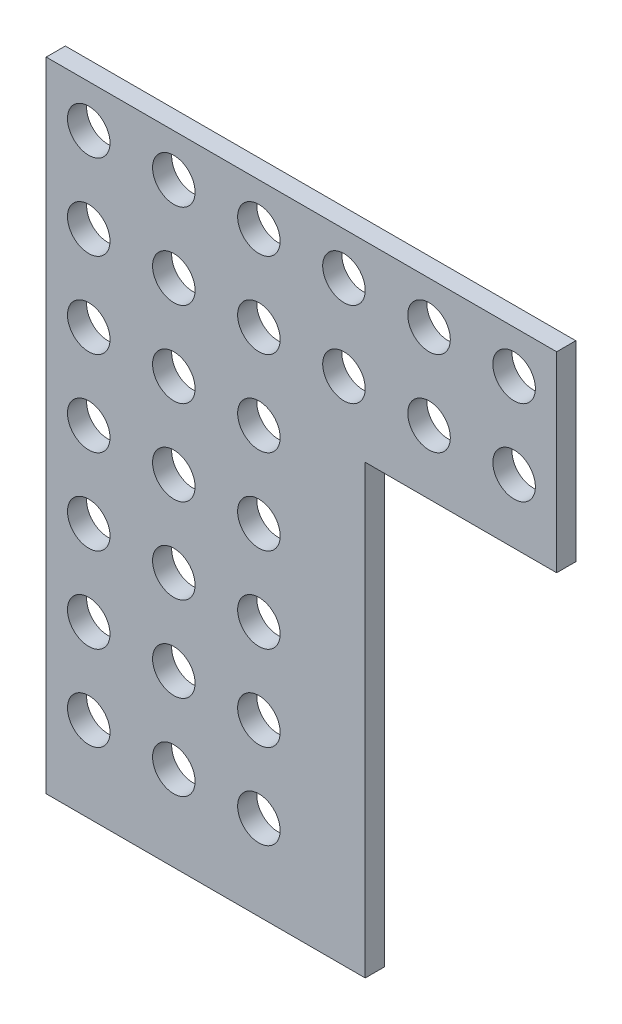
from build123d import *

# Parameters (mm, degrees)
BOSS_EXTRUDE1_DEPTH     = 4.5
SKETCH3_R               = 5
CUT_EXTRUDE1_DEPTH      = 97.152223063
FILL_PATTERN1_OUTLINE_R = 5
FILL_PATTERN1_DEPTH     = 4.5


# Read off the part's stored shape, not the designer's step: Fill Pattern1
with BuildPart() as part:
    # Sketch2 → Boss-Extrude1 (new body)
    with BuildSketch(Plane.XY):
        Polygon((15, -75), (-60, -75), (-60, 75), (60, 75), (60, 30), (15, 30), align=None)
    extrude(amount=BOSS_EXTRUDE1_DEPTH)

    # Sketch3 → Cut-Extrude1 (cut, through all)
    with BuildSketch(Plane.XY.offset(4.5)):
        with Locations((-50, 65)):
            Circle(SKETCH3_R)
    extrude(amount=-CUT_EXTRUDE1_DEPTH, mode=Mode.SUBTRACT)

    # Fill Pattern1 outline → Fill Pattern1 (cut)
    with BuildSketch(Plane.XY):
        with Locations((-30, 65)):
            Circle(FILL_PATTERN1_OUTLINE_R)
        with Locations((-30, -55)):
            Circle(FILL_PATTERN1_OUTLINE_R)
        with Locations((-10, -55)):
            Circle(FILL_PATTERN1_OUTLINE_R)
        with Locations((-50, -35)):
            Circle(FILL_PATTERN1_OUTLINE_R)
        with Locations((-30, -35)):
            Circle(FILL_PATTERN1_OUTLINE_R)
        with Locations((-50, -15)):
            Circle(FILL_PATTERN1_OUTLINE_R)
        with Locations((50, 65)):
            Circle(FILL_PATTERN1_OUTLINE_R)
        with Locations((50, 45)):
            Circle(FILL_PATTERN1_OUTLINE_R)
        with Locations((-10, -35)):
            Circle(FILL_PATTERN1_OUTLINE_R)
        with Locations((-50, -55)):
            Circle(FILL_PATTERN1_OUTLINE_R)
        with Locations((-10, 25)):
            Circle(FILL_PATTERN1_OUTLINE_R)
        with Locations((-30, 25)):
            Circle(FILL_PATTERN1_OUTLINE_R)
        with Locations((-50, 25)):
            Circle(FILL_PATTERN1_OUTLINE_R)
        with Locations((10, 65)):
            Circle(FILL_PATTERN1_OUTLINE_R)
        with Locations((-10, 45)):
            Circle(FILL_PATTERN1_OUTLINE_R)
        with Locations((-10, 65)):
            Circle(FILL_PATTERN1_OUTLINE_R)
        with Locations((-50, 45)):
            Circle(FILL_PATTERN1_OUTLINE_R)
        with Locations((-30, 45)):
            Circle(FILL_PATTERN1_OUTLINE_R)
        with Locations((-30, -15)):
            Circle(FILL_PATTERN1_OUTLINE_R)
        with Locations((-10, -15)):
            Circle(FILL_PATTERN1_OUTLINE_R)
        with Locations((30, 45)):
            Circle(FILL_PATTERN1_OUTLINE_R)
        with Locations((30, 65)):
            Circle(FILL_PATTERN1_OUTLINE_R)
        with Locations((-50, 5)):
            Circle(FILL_PATTERN1_OUTLINE_R)
        with Locations((-30, 5)):
            Circle(FILL_PATTERN1_OUTLINE_R)
        with Locations((-10, 5)):
            Circle(FILL_PATTERN1_OUTLINE_R)
        with Locations((10, 45)):
            Circle(FILL_PATTERN1_OUTLINE_R)
    extrude(amount=FILL_PATTERN1_DEPTH, mode=Mode.SUBTRACT)


solid = part.part
